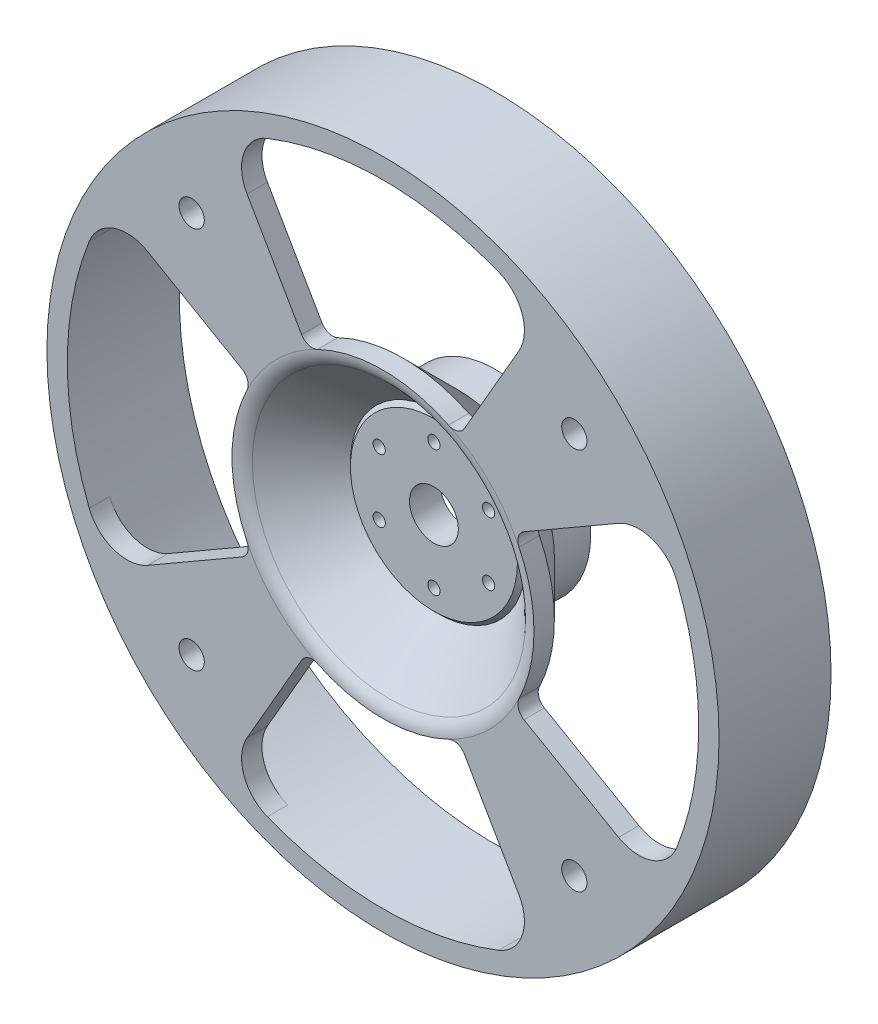
from build123d import *

# Parameters (mm, degrees)
EXTRUDE_1_DEPTH          = 20
EXTRUDE_1_DEPTH_BACK     = 7.5
SKETCH_1_R               = 82.5
SKETCH_1_R_2             = 80
EXTRUDE_3_DEPTH          = 7.5
EXTRUDE_3_DEPTH_BACK     = 7.5
SKETCH_3_R               = 21.5
CHAMFER_1_SIZE           = 1
SKETCH_4_R               = 18.5
CUT_EXTRUDE_1_DEPTH      = 7.5
SKETCH_5_R               = 1.5
CUT_EXTRUDE_2_DEPTH      = 7.5
SKETCH_6_R               = 6
CUT_EXTRUDE_3_DEPTH      = 7.5
SKETCH_9_R               = 3.1
CUT_EXTRUDE_4_DEPTH      = 119.822346
CUT_EXTRUDE_5_DEPTH      = 10
CUT_EXTRUDE_5_DEPTH_BACK = 119.822346


# Read off the part's stored shape, not the designer's step: 抽壳1
with BuildPart() as part:
    # 草图1 → 凸台-拉伸1 (new, two sides: drawn at the far end of the back side and taken through both)
    with BuildSketch(Plane.XY.offset(-EXTRUDE_1_DEPTH_BACK)):
        Circle(SKETCH_1_R)
        Circle(SKETCH_1_R_2, mode=Mode.SUBTRACT)
    extrude(amount=EXTRUDE_1_DEPTH + EXTRUDE_1_DEPTH_BACK)



with BuildPart() as body_2:
    # 草图3 → 凸台-拉伸3 (new, two sides: drawn at the far end of the back side and taken through both)
    with BuildSketch(Plane.XY.offset(-EXTRUDE_3_DEPTH_BACK)):
        Circle(SKETCH_3_R)
    extrude(amount=EXTRUDE_3_DEPTH + EXTRUDE_3_DEPTH_BACK)

    # 倒角1
    chamfer_1_edges = [body_2.edges().sort_by_distance(p)[0] for p in [
        (-21.5, 0, 7.5),
    ]]
    chamfer(chamfer_1_edges, length=CHAMFER_1_SIZE)

    # 草图4 → 切除-拉伸1 (cut)
    with BuildSketch(Plane(origin=(0, 0, -7.5), x_dir=(-1, 0, 0), z_dir=(0, 0, -1))):
        Circle(SKETCH_4_R)
    extrude(amount=-CUT_EXTRUDE_1_DEPTH, mode=Mode.SUBTRACT)

    # 草图5 → 切除-拉伸2 (cut)
    with BuildSketch(Plane.XY.offset(7.5)):
        with Locations((0, 15.5)):
            Circle(SKETCH_5_R)
        with Locations((13.423394, 7.75)):
            Circle(SKETCH_5_R)
        with Locations((13.423394, -7.75)):
            Circle(SKETCH_5_R)
        with Locations((0, -15.5)):
            Circle(SKETCH_5_R)
        with Locations((-13.423394, -7.75)):
            Circle(SKETCH_5_R)
        with Locations((-13.423394, 7.75)):
            Circle(SKETCH_5_R)
    extrude(amount=-CUT_EXTRUDE_2_DEPTH, mode=Mode.SUBTRACT)

    # 草图6 → 切除-拉伸3 (cut)
    with BuildSketch(Plane.XY.offset(7.5)):
        Circle(SKETCH_6_R)
    extrude(amount=-CUT_EXTRUDE_3_DEPTH, mode=Mode.SUBTRACT)


with BuildPart() as part_1:
    add(part.part)

    add(body_2.part)  # 旋转1 merges body 2
    # 草图8 → 旋转1 (revolve)
    with BuildSketch(Plane(origin=(0, 0, 0), x_dir=(1, 0, 0), z_dir=(0, 1, 0)), mode=Mode.PRIVATE) as revolve_1_sk:
        with BuildLine():
            Line((-37.071068, -20), (-80, -20))
            Line((-80, -20), (-80, 0))
            Line((-80, 0), (-80, 0.5))
            Line((-80, 0.5), (-80, 7.5))
            Line((-80, 7.5), (-21.5, 7.5))
            Line((-21.5, 7.5), (-21.5, -6.5))
            Line((-21.5, -6.5), (-33.535534, -18.535534))
            ThreePointArc((-33.535534, -18.535534), (-35.157651, -19.619398), (-37.071068, -20))
        make_face()
    revolve(revolve_1_sk.sketch.rotate(Axis((0, 0, 0), (0, 0, -1)), 180), axis=Axis((0, 0, 0), (0, 0, -1)))

    # 抽壳1 outline → 抽壳1 (revolve, cut)
    with BuildSketch(Plane.XZ):
        Polygon((37.071068, 15), (23.5, 1.428932), (23.5, -7.5), (77.5, -7.5), (77.5, 15), align=None)
    revolve(axis=Axis((0, 0, 0), (0, 0, 1)), mode=Mode.SUBTRACT)

    # 草图9 → 切除-拉伸4 (cut, through all)
    with BuildSketch(Plane(origin=(0, 0, 15), x_dir=(-1, 0, 0), z_dir=(0, 0, -1))):
        with Locations((-46.97, 46.97)):
            Circle(SKETCH_9_R)
        with Locations((46.97, 46.97)):
            Circle(SKETCH_9_R)
        with Locations((46.97, -46.97)):
            Circle(SKETCH_9_R)
        with Locations((-46.97, -46.97)):
            Circle(SKETCH_9_R)
    extrude(amount=-CUT_EXTRUDE_4_DEPTH, mode=Mode.SUBTRACT)

    # 草图10 → 切除-拉伸5 (cut, two sides: drawn at the far end of the back side and taken through both)
    with BuildSketch(Plane(origin=(0, 0, 15), x_dir=(-1, 0, 0), z_dir=(0, 0, -1)).offset(-CUT_EXTRUDE_5_DEPTH_BACK)):
        with BuildLine():
            Line((-33.377575, 57.811655), (-19.979305, 34.605171))
            ThreePointArc((-19.979305, 34.605171), (-18.265691, 33.238513), (-16.079948, 33.402086))
            ThreePointArc((-16.079948, 33.402086), (0, 37.071068), (16.079948, 33.402086))
            ThreePointArc((16.079948, 33.402086), (18.265691, 33.238513), (19.979305, 34.605171))
            Line((19.979305, 34.605171), (33.377575, 57.811655))
            ThreePointArc((33.377575, 57.811655), (34.157646, 66.110179), (28.379146, 72.117086))
            ThreePointArc((28.379146, 72.117086), (0, 77.5), (-28.379146, 72.117086))
            ThreePointArc((-28.379146, 72.117086), (-34.157646, 66.110179), (-33.377575, 57.811655))
        make_face()
        with BuildLine():
            Line((57.811655, 33.377575), (34.605171, 19.979305))
            ThreePointArc((34.605171, 19.979305), (33.238513, 18.265691), (33.402086, 16.079948))
            ThreePointArc((33.402086, 16.079948), (37.071068, 0), (33.402086, -16.079948))
            ThreePointArc((33.402086, -16.079948), (33.238513, -18.265691), (34.605171, -19.979305))
            Line((34.605171, -19.979305), (57.811655, -33.377575))
            ThreePointArc((57.811655, -33.377575), (66.110179, -34.157646), (72.117086, -28.379146))
            ThreePointArc((72.117086, -28.379146), (77.5, 0), (72.117086, 28.379146))
            ThreePointArc((72.117086, 28.379146), (66.110179, 34.157646), (57.811655, 33.377575))
        make_face()
        with BuildLine():
            Line((33.377575, -57.811655), (19.979305, -34.605171))
            ThreePointArc((19.979305, -34.605171), (18.265691, -33.238513), (16.079948, -33.402086))
            ThreePointArc((16.079948, -33.402086), (0, -37.071068), (-16.079948, -33.402086))
            ThreePointArc((-16.079948, -33.402086), (-18.265691, -33.238513), (-19.979305, -34.605171))
            Line((-19.979305, -34.605171), (-33.377575, -57.811655))
            ThreePointArc((-33.377575, -57.811655), (-34.157646, -66.110179), (-28.379146, -72.117086))
            ThreePointArc((-28.379146, -72.117086), (0, -77.5), (28.379146, -72.117086))
            ThreePointArc((28.379146, -72.117086), (34.157646, -66.110179), (33.377575, -57.811655))
        make_face()
        with BuildLine():
            Line((-57.811655, -33.377575), (-34.605171, -19.979305))
            ThreePointArc((-34.605171, -19.979305), (-33.238513, -18.265691), (-33.402086, -16.079948))
            ThreePointArc((-33.402086, -16.079948), (-37.071068, 0), (-33.402086, 16.079948))
            ThreePointArc((-33.402086, 16.079948), (-33.238513, 18.265691), (-34.605171, 19.979305))
            Line((-34.605171, 19.979305), (-57.811655, 33.377575))
            ThreePointArc((-57.811655, 33.377575), (-66.110179, 34.157646), (-72.117086, 28.379146))
            ThreePointArc((-72.117086, 28.379146), (-77.5, 0), (-72.117086, -28.379146))
            ThreePointArc((-72.117086, -28.379146), (-66.110179, -34.157646), (-57.811655, -33.377575))
        make_face()
    extrude(amount=CUT_EXTRUDE_5_DEPTH + CUT_EXTRUDE_5_DEPTH_BACK, mode=Mode.SUBTRACT)


solid = part_1.part
